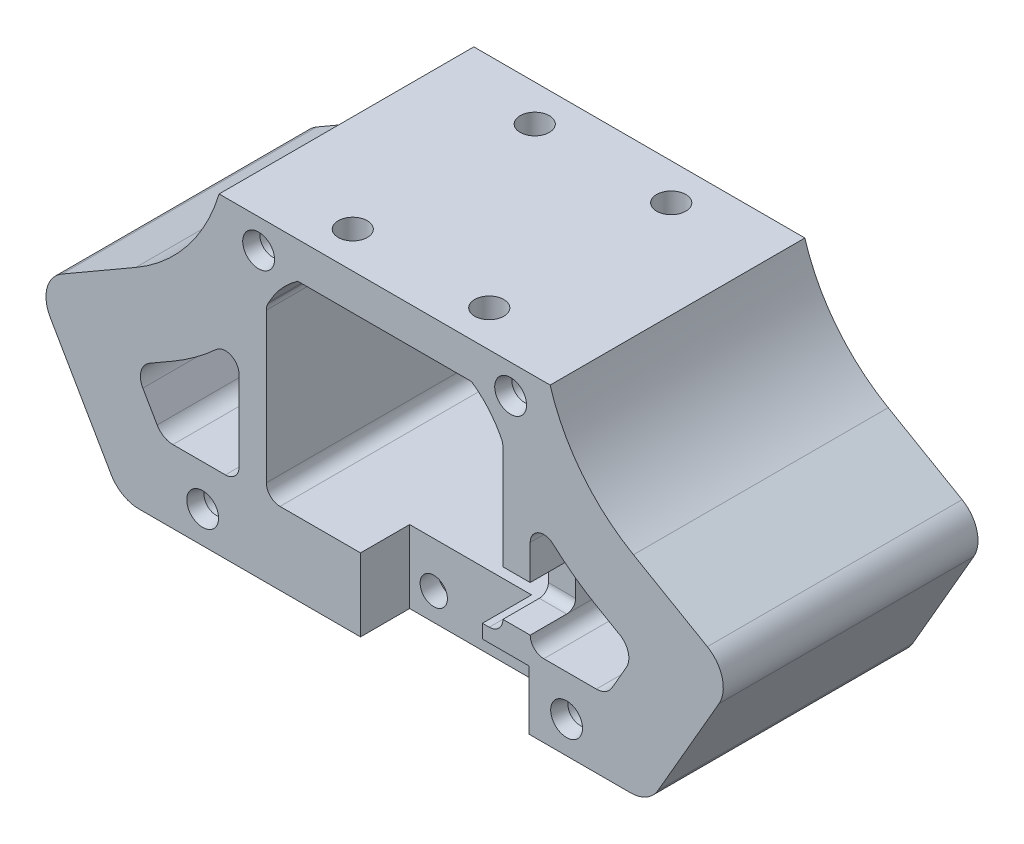
from build123d import *
from build123d.topology import SkipClean

# Parameters (mm, degrees)
CUT_EXTRUDE1_START         = -34
CUT_EXTRUDE1_2_OUTLINE_R   = 1.35
CUT_EXTRUDE1_2_OUTLINE_R_2 = 1.75
CUT_EXTRUDE1_2_DEPTH       = 28
CUT_EXTRUDE1_3_OUTLINE_W   = 3
CUT_EXTRUDE1_3_OUTLINE_H   = 5
CUT_EXTRUDE1_3_OUTLINE_R   = 1.5
CUT_EXTRUDE1_3_OUTLINE_R_2 = 1.375
CUT_EXTRUDE1_3_DEPTH       = 22.6
CUT_EXTRUDE1_4_OUTLINE_R   = 1.375
CUT_EXTRUDE1_4_OUTLINE_R_2 = 1.5
CUT_EXTRUDE1_4_DEPTH       = 16.6
CUT_EXTRUDE1_START_2       = -24
CUT_EXTRUDE1_5_OUTLINE_R   = 1.35
CUT_EXTRUDE1_5_OUTLINE_R_2 = 1.5
CUT_EXTRUDE1_5_DEPTH       = 8
CUT_EXTRUDE1_START_3       = -11.4
CUT_EXTRUDE1_6_OUTLINE_W   = 3
CUT_EXTRUDE1_6_OUTLINE_H   = 5
CUT_EXTRUDE1_6_DEPTH       = 1.4
CUT_EXTRUDE1_START_4       = -16
CUT_EXTRUDE1_7_OUTLINE_R   = 1.5
CUT_EXTRUDE1_7_DEPTH       = 2.6
CUT_EXTRUDE1_START_5       = -0.77575282
CUT_EXTRUDE1_8_OUTLINE_R   = 3
CUT_EXTRUDE1_8_DEPTH       = 5.27575282
CUT_EXTRUDE1_START_6       = 4.5
CUT_EXTRUDE1_9_OUTLINE_R   = 1.6
CUT_EXTRUDE1_9_DEPTH       = 2.206
CUT_EXTRUDE1_START_7       = 12
CUT_EXTRUDE1_10_DEPTH      = 5
BOSS_EXTRUDE1_START        = 1.778
SKETCH4_R                  = 3
SKETCH4_R_2                = 1.6
BOSS_EXTRUDE1_DEPTH        = 1.778
BOSS_EXTRUDE2_START        = -28
BOSS_EXTRUDE2_DEPTH        = 28
CUT_EXTRUDE2_START         = -3.984
SKETCH5_R                  = 1.6
CUT_EXTRUDE2_DEPTH         = 3.984


with BuildPart() as part:
    # Cut-Extrude1: read off the stored shape, not the designer's step
    # Cut-Extrude1 outline → Cut-Extrude1 (revolve)
    with BuildSketch(Plane(origin=(20, -24.191620804, 0), x_dir=(1, 0, 0), z_dir=(0, -1, 0))):
        Polygon((1.75, -34), (1.75, -6), (1.35, -7.492820323), (1.35, -16), (0, -16), (0, -24), (1.35, -24), (1.35, -32.507179677), align=None)
    revolve(axis=Axis((20, -24.191620804, 0), (0, 0, 1)))

    # Cut-Extrude1 2 outline → Cut-Extrude1 2 (add)
    with BuildSketch(Plane.XY.offset(CUT_EXTRUDE1_START)):
        with BuildLine():
            ThreePointArc((-12.671611267, -0.77575282), (-8.993927105, 3.080281808), (-3.857901005, 4.5))
            Line((-3.857901005, 4.5), (3.857901005, 4.5))
            ThreePointArc((3.857901005, 4.5), (8.993927105, 3.080281808), (12.671611267, -0.77575282))
            ThreePointArc((12.671611267, -0.77575282), (12.742657608, -0.90745279), (12.81440678, -1.038771185))
            ThreePointArc((12.81440678, -1.038771185), (12.952861, -1.388410184), (13, -1.761498532))
            Line((13, -1.761498532), (13, -13.191620804))
            Line((13, -13.191620804), (16, -13.191620804))
            Line((16, -13.191620804), (16, -9.370498043))
            ThreePointArc((16, -9.370498043), (16.89336298, -7.998641081), (18.509322034, -8.260872417))
            ThreePointArc((18.509322034, -8.260872417), (20.8347699, -10.158636348), (23.35, -11.79657202))
            Line((23.35, -11.79657202), (25.844171186, -13.236582426))
            ThreePointArc((25.844171186, -13.236582426), (26.776022839, -14.450995143), (26.576221994, -15.968633234))
            Line((26.576221994, -15.968633234), (25.004104387, -18.691620804))
            ThreePointArc((25.004104387, -18.691620804), (24.272053579, -19.423671612), (23.272053579, -19.691620804))
            Line((23.272053579, -19.691620804), (17.5, -19.691620804))
            ThreePointArc((17.5, -19.691620804), (16.439339828, -19.252280976), (16, -18.191620804))
            Line((16, -18.191620804), (13, -18.191620804))
            ThreePointArc((13, -18.191620804), (12.560660172, -19.252280976), (11.5, -19.691620804))
            Line((11.5, -19.691620804), (10.75, -19.691620804))
            Line((10.75, -19.691620804), (10.75, -21.191620804))
            Line((10.75, -21.191620804), (15.85, -21.191620804))
            Line((15.85, -21.191620804), (15.85, -27.691620804))
            Line((15.85, -27.691620804), (27.024830329, -27.691620804))
            ThreePointArc((27.024830329, -27.691620804), (28.774830329, -27.222709717), (30.055919242, -25.941620804))
            Line((30.055919242, -25.941620804), (36.754425224, -14.339468109))
            ThreePointArc((36.754425224, -14.339468109), (37.104076703, -11.683601451), (35.473336311, -9.558379196))
            Line((35.473336311, -9.558379196), (27.35, -4.86836879))
            ThreePointArc((27.35, -4.86836879), (21.664948833, 0.043304937), (18.193228787, 6.706))
            Line((18.193228787, 6.706), (-18.193228787, 6.706))
            ThreePointArc((-18.193228787, 6.706), (-21.664948833, 0.043304937), (-27.35, -4.86836879))
            Line((-27.35, -4.86836879), (-35.473336311, -9.558379196))
            ThreePointArc((-35.473336311, -9.558379196), (-37.104076703, -11.683601451), (-36.754425224, -14.339468109))
            Line((-36.754425224, -14.339468109), (-30.055919242, -25.941620804))
            ThreePointArc((-30.055919242, -25.941620804), (-28.774830329, -27.222709717), (-27.024830329, -27.691620804))
            Line((-27.024830329, -27.691620804), (-2.65, -27.691620804))
            Line((-2.65, -27.691620804), (-2.65, -19.691620804))
            Line((-2.65, -19.691620804), (-11.5, -19.691620804))
            ThreePointArc((-11.5, -19.691620804), (-12.560660172, -19.252280976), (-13, -18.191620804))
            Line((-13, -18.191620804), (-13, -1.761498532))
            ThreePointArc((-13, -1.761498532), (-12.952861, -1.388410184), (-12.81440678, -1.038771185))
            ThreePointArc((-12.81440678, -1.038771185), (-12.742657608, -0.90745279), (-12.671611267, -0.77575282))
        make_face()
        with Locations((-20, -24.191620804)):
            Circle(CUT_EXTRUDE1_2_OUTLINE_R, mode=Mode.SUBTRACT)
        with BuildLine():
            Line((-25.844171186, -13.236582426), (-23.35, -11.79657202))
            ThreePointArc((-23.35, -11.79657202), (-20.8347699, -10.158636348), (-18.509322034, -8.260872417))
            ThreePointArc((-18.509322034, -8.260872417), (-16.89336298, -7.998641081), (-16, -9.370498043))
            Line((-16, -9.370498043), (-16, -18.191620804))
            ThreePointArc((-16, -18.191620804), (-16.439339828, -19.252280976), (-17.5, -19.691620804))
            Line((-17.5, -19.691620804), (-23.272053579, -19.691620804))
            ThreePointArc((-23.272053579, -19.691620804), (-24.272053579, -19.423671612), (-25.004104387, -18.691620804))
            Line((-25.004104387, -18.691620804), (-26.576221994, -15.968633234))
            ThreePointArc((-26.576221994, -15.968633234), (-26.776022839, -14.450995143), (-25.844171186, -13.236582426))
        make_face(mode=Mode.SUBTRACT)
        with Locations((20, -24.191620804)):
            Circle(CUT_EXTRUDE1_2_OUTLINE_R_2, mode=Mode.SUBTRACT)
        with Locations((-13.85, 3.5)):
            Circle(CUT_EXTRUDE1_2_OUTLINE_R, mode=Mode.SUBTRACT)
        with Locations((13.85, 3.5)):
            Circle(CUT_EXTRUDE1_2_OUTLINE_R, mode=Mode.SUBTRACT)
    extrude(amount=CUT_EXTRUDE1_2_DEPTH)

    # Cut-Extrude1 3 outline → Cut-Extrude1 3 (add)
    # profile 1 of 2: a face of its own
    with BuildSketch(Plane.XY.offset(CUT_EXTRUDE1_START)):
        with Locations((14.5, -15.691620804)):
            Rectangle(CUT_EXTRUDE1_3_OUTLINE_W, CUT_EXTRUDE1_3_OUTLINE_H)
    # profile 2 of 2: a face of its own
    with BuildSketch(Plane.XY.offset(CUT_EXTRUDE1_START)):
        Polygon((10.75, -19.691620804), (-2.65, -19.691620804), (-2.65, -27.691620804), (15.85, -27.691620804), (15.85, -21.191620804), (10.75, -21.191620804), align=None)
        with Locations((0, -24.691620804)):
            Circle(CUT_EXTRUDE1_3_OUTLINE_R, mode=Mode.SUBTRACT)
        with Locations((13, -24.691620804)):
            Circle(CUT_EXTRUDE1_3_OUTLINE_R_2, mode=Mode.SUBTRACT)
    extrude(amount=CUT_EXTRUDE1_3_DEPTH)

    # Cut-Extrude1 4 outline → Cut-Extrude1 4 (add)
    with BuildSketch(Plane.XY.offset(CUT_EXTRUDE1_START)):
        with Locations((13, -24.691620804)):
            Circle(CUT_EXTRUDE1_4_OUTLINE_R)
        with Locations((0, -24.691620804)):
            Circle(CUT_EXTRUDE1_4_OUTLINE_R_2)
    extrude(amount=CUT_EXTRUDE1_4_DEPTH)

    # Cut-Extrude1 5 outline → Cut-Extrude1 5 (add)
    with BuildSketch(Plane.XY.offset(CUT_EXTRUDE1_START_2)):
        with Locations((-20, -24.191620804)):
            Circle(CUT_EXTRUDE1_5_OUTLINE_R)
        with Locations((-13.85, 3.5)):
            Circle(CUT_EXTRUDE1_5_OUTLINE_R)
        with Locations((13.85, 3.5)):
            Circle(CUT_EXTRUDE1_5_OUTLINE_R)
        with Locations((0, -24.691620804)):
            Circle(CUT_EXTRUDE1_5_OUTLINE_R_2)
    extrude(amount=CUT_EXTRUDE1_5_DEPTH)

    # Cut-Extrude1 6 outline → Cut-Extrude1 6 (add)
    with BuildSketch(Plane.XY.offset(CUT_EXTRUDE1_START_3)):
        with Locations((14.5, -15.691620804)):
            Rectangle(CUT_EXTRUDE1_6_OUTLINE_W, CUT_EXTRUDE1_6_OUTLINE_H)
    extrude(amount=CUT_EXTRUDE1_6_DEPTH)

    # Cut-Extrude1 7 outline → Cut-Extrude1 7 (add)
    with BuildSketch(Plane.XY.offset(CUT_EXTRUDE1_START_4)):
        with Locations((0, -24.691620804)):
            Circle(CUT_EXTRUDE1_7_OUTLINE_R)
    extrude(amount=CUT_EXTRUDE1_7_DEPTH)

    # Cut-Extrude1 8 outline → Cut-Extrude1 8 (cut)
    with BuildSketch(Plane(origin=(0, 0, 0), x_dir=(1, 0, 0), z_dir=(0, 1, 0)).offset(CUT_EXTRUDE1_START_5)):
        with Locations((-7.5, 10)):
            Circle(CUT_EXTRUDE1_8_OUTLINE_R)
        with Locations((-7.5, 30)):
            Circle(CUT_EXTRUDE1_8_OUTLINE_R)
        with Locations((7.5, 30)):
            Circle(CUT_EXTRUDE1_8_OUTLINE_R)
        with Locations((7.5, 10)):
            Circle(CUT_EXTRUDE1_8_OUTLINE_R)
    extrude(amount=CUT_EXTRUDE1_8_DEPTH, mode=Mode.SUBTRACT)

    # Cut-Extrude1 9 outline → Cut-Extrude1 9 (cut)
    with BuildSketch(Plane(origin=(0, 0, 0), x_dir=(1, 0, 0), z_dir=(0, 1, 0)).offset(CUT_EXTRUDE1_START_6)):
        with Locations((-7.5, 10)):
            Circle(CUT_EXTRUDE1_9_OUTLINE_R)
        with Locations((-7.5, 30)):
            Circle(CUT_EXTRUDE1_9_OUTLINE_R)
        with Locations((7.5, 30)):
            Circle(CUT_EXTRUDE1_9_OUTLINE_R)
        with Locations((7.5, 10)):
            Circle(CUT_EXTRUDE1_9_OUTLINE_R)
    extrude(amount=CUT_EXTRUDE1_9_DEPTH, mode=Mode.SUBTRACT)

    # Cut-Extrude1 10 outline → Cut-Extrude1 10 (cut)
    with BuildSketch(Plane.YZ.offset(CUT_EXTRUDE1_START_7)):
        with BuildLine():
            ThreePointArc((-14.191620804, -11), (-13.484514023, -10.707106781), (-13.191620804, -10))
            Line((-13.191620804, -10), (-18.191620804, -10))
            ThreePointArc((-18.191620804, -10), (-17.898727585, -10.707106781), (-17.191620804, -11))
            Line((-17.191620804, -11), (-14.191620804, -11))
        make_face()
    extrude(amount=CUT_EXTRUDE1_10_DEPTH, mode=Mode.SUBTRACT)

    # Cut-Extrude1 11 outline → Cut-Extrude1 11 (revolve, cut)
    with BuildSketch(Plane.XZ):
        Polygon((6, -34), (4.499558758, -27.998235034), (4.499558758, -34), align=None)
    revolve(axis=Axis((0, 0, 0), (0, 0, 1)), mode=Mode.SUBTRACT)

    # Cut-Extrude1 12 outline → Cut-Extrude1 12 (revolve, cut)
    with BuildSketch(Plane(origin=(-20, -24.191620804, 0), x_dir=(1, 0, 0), z_dir=(0, -1, 0))):
        Polygon((1.75, -34), (1.35, -32.507179677), (1.35, -34), align=None)
        Polygon((1.35, -6), (1.35, -7.492820323), (1.75, -6), align=None)
    revolve(axis=Axis((-20, -24.191620804, 0), (0, 0, 1)), mode=Mode.SUBTRACT)

    # Cut-Extrude1 13 outline → Cut-Extrude1 13 (revolve, cut)
    with BuildSketch(Plane(origin=(-13.85, 3.5, 0), x_dir=(1, 0, 0), z_dir=(0, -1, 0))):
        Polygon((1.75, -34), (1.35, -32.507179677), (1.35, -34), align=None)
        Polygon((1.35, -6), (1.35, -7.492820323), (1.75, -6), align=None)
    revolve(axis=Axis((-13.85, 3.5, 0), (0, 0, 1)), mode=Mode.SUBTRACT)

    # Cut-Extrude1 14 outline → Cut-Extrude1 14 (revolve, cut)
    with BuildSketch(Plane(origin=(13.85, 3.5, 0), x_dir=(1, 0, 0), z_dir=(0, -1, 0))):
        Polygon((1.75, -34), (1.35, -32.507179677), (1.35, -34), align=None)
        Polygon((1.35, -6), (1.35, -7.492820323), (1.75, -6), align=None)
    revolve(axis=Axis((13.85, 3.5, 0), (0, 0, 1)), mode=Mode.SUBTRACT)

    # Cut-Extrude1 15 outline → Cut-Extrude1 15 (revolve, cut)
    with BuildSketch(Plane(origin=(13, -24.691620804, 0), x_dir=(1, 0, 0), z_dir=(0, -1, 0))):
        Polygon((1.375, -11.4), (1.375, -12.892820323), (1.775, -11.4), align=None)
    revolve(axis=Axis((13, -24.691620804, 0), (0, 0, 1)), mode=Mode.SUBTRACT)

    # Sketch4 → Boss-Extrude1 (add)
    # profile 1 of 4: a face of its own
    with SkipClean():  # the faces are left unmerged after this step: merging them gives an invalid solid
        with BuildSketch(Plane.XZ.offset(-4.5).offset(BOSS_EXTRUDE1_START)):
            with Locations((-7.5, -10)):
                Circle(SKETCH4_R)
            with Locations(Location((-7.5, -10, 0), (0, 0, 270))):
                Circle(SKETCH4_R_2, mode=Mode.SUBTRACT)
        # profile 2 of 4: a face of its own
        with BuildSketch(Plane.XZ.offset(-4.5).offset(BOSS_EXTRUDE1_START)):
            with Locations((-7.5, -30)):
                Circle(SKETCH4_R)
            with Locations(Location((-7.5, -30, 0), (0, 0, 270))):
                Circle(SKETCH4_R_2, mode=Mode.SUBTRACT)
        # profile 3 of 4: a face of its own
        with BuildSketch(Plane.XZ.offset(-4.5).offset(BOSS_EXTRUDE1_START)):
            with Locations((7.5, -10)):
                Circle(SKETCH4_R)
            with Locations(Location((7.5, -10, 0), (0, 0, 270))):
                Circle(SKETCH4_R_2, mode=Mode.SUBTRACT)
        # profile 4 of 4: a face of its own
        with BuildSketch(Plane.XZ.offset(-4.5).offset(BOSS_EXTRUDE1_START)):
            with Locations((7.5, -30)):
                Circle(SKETCH4_R)
            with Locations(Location((7.5, -30, 0), (0, 0, 270))):
                Circle(SKETCH4_R_2, mode=Mode.SUBTRACT)
        extrude(amount=-BOSS_EXTRUDE1_DEPTH)

    # Sketch3 → Boss-Extrude2 (add)
    with SkipClean():  # the faces are left unmerged after this step: merging them gives an invalid solid
        with BuildSketch(Plane.XY.offset(-6).offset(BOSS_EXTRUDE2_START)):
            with BuildLine():
                Line((-3.857901005, 4.5), (3.857901005, 4.5))
                ThreePointArc((3.857901005, 4.5), (6.839511309, 4.045155839), (9.549888005, 2.722))
                Line((9.549888005, 2.722), (-9.549888005, 2.722))
                ThreePointArc((-9.549888005, 2.722), (-6.839511309, 4.045155839), (-3.857901005, 4.5))
            make_face()
        extrude(amount=BOSS_EXTRUDE2_DEPTH)

    # Sketch5 → Cut-Extrude2 (cut)
    with SkipClean():  # the faces are left unmerged after this step: merging them gives an invalid solid
        with BuildSketch(Plane(origin=(0, 6.706, 0), x_dir=(1, 0, 0), z_dir=(0, 1, 0)).offset(CUT_EXTRUDE2_START)):
            with Locations(Location((7.5, 30, 0), (0, 0, 90))):
                Circle(SKETCH5_R)
            with Locations(Location((7.5, 10, 0), (0, 0, 90))):
                Circle(SKETCH5_R)
            with Locations(Location((-7.5, 10, 0), (0, 0, 90))):
                Circle(SKETCH5_R)
            with Locations(Location((-7.5, 30, 0), (0, 0, 90))):
                Circle(SKETCH5_R)
        extrude(amount=CUT_EXTRUDE2_DEPTH, mode=Mode.SUBTRACT)

    # Sketch6 → Cut-Revolve1 (revolve, cut)
    with SkipClean():  # the faces are left unmerged after this step: merging them gives an invalid solid
        with BuildSketch(Plane(origin=(0, 0, 0), x_dir=(0, 0, -1), z_dir=(1, 0, 0))):
            Polygon((34, 6), (20.888, 2.722), (34, 2.722), align=None)
        revolve(axis=Axis((0, 0, 0), (0, 0, -1)), mode=Mode.SUBTRACT)


solid = part.part
